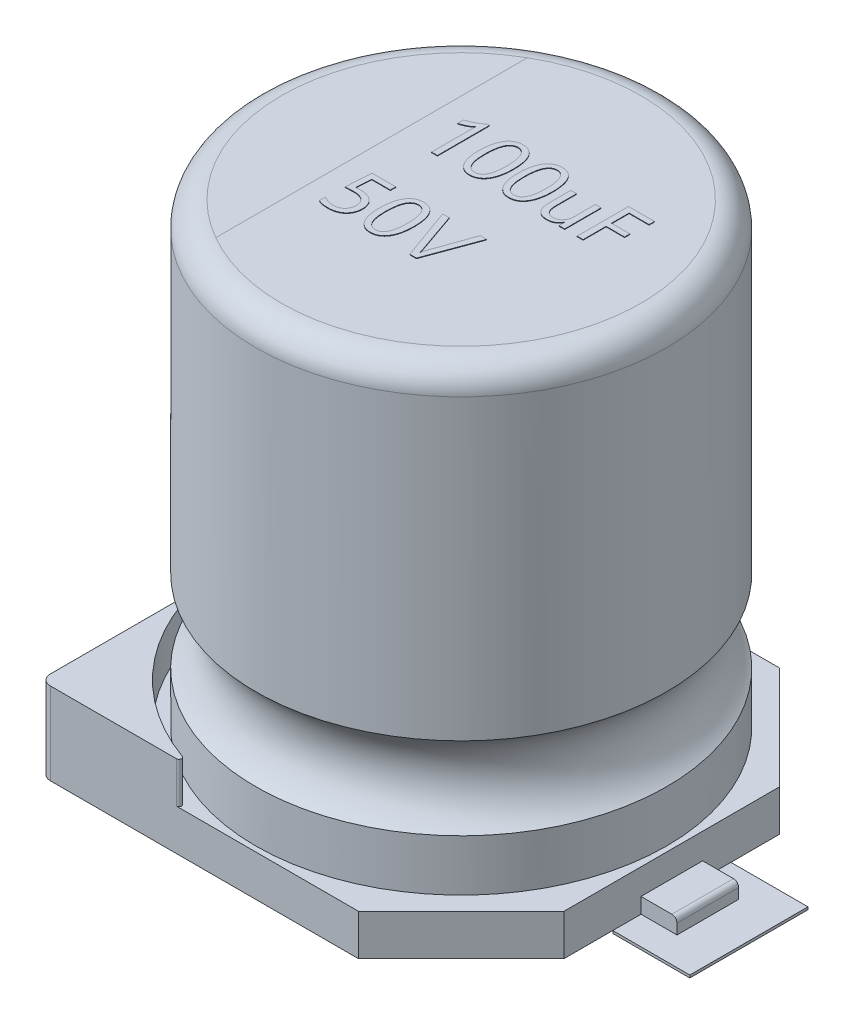
from build123d import *

# Parameters (mm, degrees)
SKETCH1_R             = 4
BOSS_EXTRUDE1_DEPTH   = 8.9
FILLET1_R             = 0.5
SKETCH3_W             = 8.2
SKETCH3_H             = 8.2
BOSS_EXTRUDE2_DEPTH   = 0.8
CHAMFER1_SIZE         = 2
BOSS_EXTRUDE3_DEPTH   = 0.8
FILLET2_R             = 0.05
SKETCH5_W             = 1.2
SKETCH5_H             = 0.3
BOSS_EXTRUDE4_DEPTH   = 0.7
FILLET3_R             = 0.1
FILLET4_R             = 0.2
BOSS_EXTRUDE5_DEPTH   = 0.01
SKETCH8_W             = 1.5
SKETCH8_H             = 2.3
BOSS_EXTRUDE6_DEPTH   = 0.05
BOSS_EXTRUDE6_2_DEPTH = 0.05


with BuildPart() as part:
    # Sketch1 → Boss-Extrude1 (new body)
    with BuildSketch(Plane(origin=(0, 0, 0), x_dir=(1, 0, 0), z_dir=(0, 1, 0))):
        Circle(SKETCH1_R)
    extrude(amount=BOSS_EXTRUDE1_DEPTH)

    # Sketch2 → Cut-Revolve1 (revolve, cut)
    with BuildSketch(Plane.XY):
        with BuildLine():
            Line((-4, 2.6), (-4, 1))
            ThreePointArc((-4, 1), (-3.6, 1.8), (-4, 2.6))
        make_face()
    revolve(axis=Axis((0, 0, 0), (0, 1, 0)), mode=Mode.SUBTRACT)

    # Fillet1
    fillet1_edges = [part.edges().sort_by_distance(p)[0] for p in [
        (-4, 8.9, 0),
    ]]
    fillet(fillet1_edges, radius=FILLET1_R)

    # Sketch7 → Boss-Extrude5 (add)
    # profile 1 of 8: a face of its own
    with BuildSketch(Plane(origin=(0, 8.9, 0), x_dir=(1, 0, 0), z_dir=(0, 1, 0))):
        with BuildLine():
            Line((-0.963431723, 0.500188603), (-1.07732975, 0.500188603))
            Line((-1.07732975, 0.500188603), (-1.07732975, 1.355040577))
            add(Edge.make_bspline(
                [(-1.07732975, 1.355040577), (-1.079777093, 1.352756928), (-1.085034792, 1.3478509), (-1.09387705, 1.340498161), (-1.104208441, 1.332640753), (-1.12049976, 1.321512017), (-1.14335142, 1.307312876), (-1.173085751, 1.290498318), (-1.20548104, 1.274747136), (-1.239040454, 1.259578397), (-1.273144639, 1.246529775), (-1.296298393, 1.240145156), (-1.307592907, 1.237030708)],
                knots=[0, 0, 0, 0, 0.385015468, 0.827139693, 1.322250538, 1.877706807, 3.096125656, 4.416274777, 5.805430079, 7.238282366, 8.652820666, 10, 10, 10, 10], degree=3))
            Line((-1.307592907, 1.237030708), (-1.307592907, 1.352162287))
            add(Edge.make_bspline(
                [(-1.307592907, 1.352162287), (-1.294653334, 1.35610978), (-1.267783898, 1.364306875), (-1.227473316, 1.380221553), (-1.186459456, 1.398993626), (-1.14575269, 1.419805536), (-1.106604769, 1.442327949), (-1.069663837, 1.465477943), (-1.036198144, 1.488813595), (-1.016101286, 1.505474617), (-1.006606065, 1.513346498)],
                knots=[0, 0, 0, 0, 0.94458981, 1.961470684, 3.023913207, 4.09427277, 5.153432408, 6.177318749, 7.138832524, 8, 8, 8, 8], degree=3))
            Line((-1.006606065, 1.513346498), (-0.963431723, 1.513346498))
            Line((-0.963431723, 1.513346498), (-0.963431723, 0.500188603))
        make_face()
    # profile 2 of 8: a face of its own
    with BuildSketch(Plane(origin=(0, 8.9, 0), x_dir=(1, 0, 0), z_dir=(0, 1, 0))):
        with BuildLine():
            add(Edge.make_bspline(
                [(0.005112685, 1.004711629), (0.004826131, 0.984557566), (0.004268968, 0.945370772), (0.00026028, 0.888304877), (-0.00697127, 0.834774088), (-0.01670279, 0.78474756), (-0.029197763, 0.738431643), (-0.044185511, 0.695758481), (-0.061768763, 0.65682236), (-0.081983566, 0.621736309), (-0.104311728, 0.590281443), (-0.129707187, 0.563262978), (-0.157079658, 0.539685765), (-0.187165811, 0.520517467), (-0.219425585, 0.505217818), (-0.254139435, 0.495007822), (-0.29072768, 0.488007663), (-0.315919286, 0.487360705), (-0.328768894, 0.487030708)],
                knots=[0, 0, 0, 0, 1.398980466, 2.720124312, 3.96812368, 5.146432578, 6.255415985, 7.295087503, 8.282879546, 9.216336252, 10.102253837, 10.953825877, 11.784043498, 12.603506409, 13.42284504, 14.253498671, 15.109153359, 16, 16, 16, 16], degree=3))
            add(Edge.make_bspline(
                [(-0.328768894, 0.487030708), (-0.340926926, 0.487403858), (-0.36472116, 0.488134142), (-0.399403608, 0.494513325), (-0.432131855, 0.504747043), (-0.462749696, 0.519260787), (-0.491170149, 0.537718507), (-0.517128174, 0.560078852), (-0.540797909, 0.586154425), (-0.562204288, 0.615858168), (-0.581056959, 0.649361911), (-0.597559877, 0.686395783), (-0.611358843, 0.727057537), (-0.623154052, 0.771117384), (-0.632024842, 0.818768253), (-0.638552103, 0.869693802), (-0.642510507, 0.923988105), (-0.642912284, 0.961256343), (-0.643119223, 0.980451761)],
                knots=[0, 0, 0, 0, 0.888155269, 1.738190458, 2.568434008, 3.38864091, 4.207101744, 5.03849325, 5.886044594, 6.7759361, 7.709272942, 8.69152049, 9.735599895, 10.845083744, 12.023162705, 13.27590253, 14.596923554, 16, 16, 16, 16], degree=3))
            add(Edge.make_bspline(
                [(-0.643119223, 0.980451761), (-0.642843557, 1.001497645), (-0.642307836, 1.042397677), (-0.638162264, 1.101825233), (-0.631477783, 1.157428823), (-0.622151233, 1.20925434), (-0.609844107, 1.257126333), (-0.595126484, 1.301093022), (-0.577891285, 1.341086758), (-0.557950963, 1.376997022), (-0.535517212, 1.40900922), (-0.510275956, 1.436746934), (-0.482599403, 1.460461121), (-0.452195954, 1.479788402), (-0.419394292, 1.49483533), (-0.384192765, 1.505504416), (-0.346852143, 1.512337738), (-0.321123895, 1.513005818), (-0.308004092, 1.513346498)],
                knots=[0, 0, 0, 0, 1.426258677, 2.771754592, 4.035124818, 5.220331935, 6.337825632, 7.382114204, 8.359741748, 9.284994213, 10.161296122, 11.002979272, 11.820109764, 12.624106341, 13.436709906, 14.257961594, 15.111668944, 16, 16, 16, 16], degree=3))
            add(Edge.make_bspline(
                [(-0.308004092, 1.513346498), (-0.295368868, 1.512959369), (-0.270705783, 1.512203721), (-0.23495184, 1.506094994), (-0.201540462, 1.496387059), (-0.170760666, 1.482139609), (-0.14236875, 1.464156343), (-0.116378867, 1.442121729), (-0.09317833, 1.415950319), (-0.072122691, 1.3860259), (-0.054102459, 1.351883719), (-0.03785807, 1.31408476), (-0.024755916, 1.272056949), (-0.013614383, 1.226276634), (-0.005386797, 1.176431001), (0.000747166, 1.12277945), (0.004461983, 1.065070853), (0.004890986, 1.025276442), (0.005112685, 1.004711629)],
                knots=[0, 0, 0, 0, 0.899241396, 1.755257189, 2.575108327, 3.369931066, 4.161902333, 4.96169813, 5.78762661, 6.645962214, 7.56082504, 8.531597655, 9.571777694, 10.691464586, 11.88443752, 13.166498411, 14.535713275, 16, 16, 16, 16], degree=3))
        make_face()
        with BuildLine():
            add(Edge.make_bspline(
                [(-0.111458039, 0.993198471), (-0.111635005, 1.010469562), (-0.111977861, 1.043930687), (-0.114064832, 1.092507874), (-0.118353658, 1.137667761), (-0.12339049, 1.179587018), (-0.13070288, 1.218050581), (-0.139128469, 1.253280964), (-0.149453536, 1.285169971), (-0.161197046, 1.313719893), (-0.174667974, 1.338955551), (-0.189638832, 1.360931968), (-0.206310236, 1.379614653), (-0.224648836, 1.394887973), (-0.244573932, 1.406866101), (-0.266277141, 1.414960968), (-0.289367294, 1.420441518), (-0.305366891, 1.42097051), (-0.313555079, 1.421241235)],
                knots=[0, 0, 0, 0, 1.581181307, 3.063391078, 4.449305256, 5.73327765, 6.92683892, 8.031533681, 9.047337031, 9.992258722, 10.853979057, 11.661441156, 12.421081853, 13.138403699, 13.838846326, 14.537910874, 15.251739941, 16, 16, 16, 16], degree=3))
            add(Edge.make_bspline(
                [(-0.313555079, 1.421241235), (-0.322149139, 1.420956637), (-0.339019139, 1.420397978), (-0.363407175, 1.415083426), (-0.386204613, 1.406638965), (-0.407231815, 1.394518687), (-0.426456861, 1.378867186), (-0.444102981, 1.359920592), (-0.459894199, 1.337502337), (-0.474045623, 1.311820005), (-0.486699712, 1.28281579), (-0.497086535, 1.250213365), (-0.506460167, 1.214429829), (-0.513622413, 1.175157744), (-0.519677256, 1.132653105), (-0.523608913, 1.086666414), (-0.526124054, 1.037292279), (-0.52640388, 1.003207366), (-0.5265485, 0.985591563)],
                knots=[0, 0, 0, 0, 0.764995805, 1.501674303, 2.212925961, 2.924256282, 3.65393935, 4.414460527, 5.224546987, 6.091227052, 7.023912083, 8.039810551, 9.137474513, 10.318540051, 11.595133009, 12.962565651, 14.430189818, 16, 16, 16, 16], degree=3))
            add(Edge.make_bspline(
                [(-0.5265485, 0.985591563), (-0.526402041, 0.969209241), (-0.526118139, 0.937452912), (-0.523614364, 0.891364271), (-0.519634554, 0.848405362), (-0.513809401, 0.808633363), (-0.506874679, 0.771954437), (-0.497741057, 0.738621381), (-0.487380411, 0.708264032), (-0.475039657, 0.681192385), (-0.461392387, 0.656982181), (-0.445580087, 0.636351776), (-0.428514073, 0.618478865), (-0.409363524, 0.604260881), (-0.388775468, 0.592951387), (-0.366538931, 0.58487104), (-0.342611158, 0.580072872), (-0.326118398, 0.579453407), (-0.317666921, 0.579135971)],
                knots=[0, 0, 0, 0, 1.543513286, 2.992024866, 4.347767877, 5.607075833, 6.778486024, 7.862468221, 8.861099137, 9.797386861, 10.662401359, 11.473455982, 12.240599663, 12.983190345, 13.711379138, 14.446775782, 15.204072658, 16, 16, 16, 16], degree=3))
            add(Edge.make_bspline(
                [(-0.317666921, 0.579135971), (-0.309354713, 0.579462603), (-0.293070777, 0.580102486), (-0.269360779, 0.584815964), (-0.247382033, 0.593201099), (-0.226927748, 0.604593384), (-0.208308613, 0.619420262), (-0.191318052, 0.637397511), (-0.175736559, 0.658496883), (-0.162459537, 0.683184252), (-0.150125444, 0.710733256), (-0.13984854, 0.741627939), (-0.130992629, 0.77569519), (-0.123969588, 0.813015594), (-0.118126249, 0.85347046), (-0.114459312, 0.897202574), (-0.111866128, 0.944099177), (-0.111597053, 0.976472965), (-0.111458039, 0.993198471)],
                knots=[0, 0, 0, 0, 0.775360401, 1.518961016, 2.243373551, 2.96192122, 3.694889719, 4.454670758, 5.264184671, 6.134259122, 7.064577354, 8.077594077, 9.167837551, 10.346585987, 11.618858978, 12.979815247, 14.439659868, 16, 16, 16, 16], degree=3))
        make_face(mode=Mode.SUBTRACT)
    # profile 3 of 8: a face of its own
    with BuildSketch(Plane(origin=(0, 8.9, 0), x_dir=(1, 0, 0), z_dir=(0, 1, 0))):
        with BuildLine():
            add(Edge.make_bspline(
                [(0.768270579, 1.004711629), (0.767984026, 0.984557566), (0.767426863, 0.945370772), (0.763418175, 0.888304877), (0.756186625, 0.834774088), (0.746455105, 0.78474756), (0.733960132, 0.738431643), (0.718972384, 0.695758481), (0.701389132, 0.65682236), (0.681174329, 0.621736309), (0.658846167, 0.590281443), (0.633450707, 0.563262978), (0.606078237, 0.539685765), (0.575992083, 0.520517467), (0.54373231, 0.505217818), (0.50901846, 0.495007822), (0.472430214, 0.488007663), (0.447238608, 0.487360705), (0.434389, 0.487030708)],
                knots=[0, 0, 0, 0, 1.398980466, 2.720124312, 3.96812368, 5.146432578, 6.255415985, 7.295087503, 8.282879546, 9.216336252, 10.102253837, 10.953825877, 11.784043498, 12.603506409, 13.42284504, 14.253498671, 15.109153359, 16, 16, 16, 16], degree=3))
            add(Edge.make_bspline(
                [(0.434389, 0.487030708), (0.422230969, 0.487403858), (0.398436735, 0.488134142), (0.363754287, 0.494513325), (0.331026039, 0.504747043), (0.300408199, 0.519260787), (0.271987746, 0.537718507), (0.246029721, 0.560078852), (0.222359986, 0.586154425), (0.200953607, 0.615858168), (0.182100935, 0.649361911), (0.165598018, 0.686395783), (0.151799052, 0.727057537), (0.140003843, 0.771117384), (0.131133053, 0.818768253), (0.124605791, 0.869693802), (0.120647388, 0.923988105), (0.120245611, 0.961256343), (0.120038671, 0.980451761)],
                knots=[0, 0, 0, 0, 0.888155269, 1.738190458, 2.568434008, 3.38864091, 4.207101744, 5.03849325, 5.886044594, 6.7759361, 7.709272942, 8.69152049, 9.735599895, 10.845083744, 12.023162705, 13.27590253, 14.596923554, 16, 16, 16, 16], degree=3))
            add(Edge.make_bspline(
                [(0.120038671, 0.980451761), (0.120314337, 1.001497645), (0.120850059, 1.042397677), (0.124995631, 1.101825233), (0.131680111, 1.157428823), (0.141006661, 1.20925434), (0.153313788, 1.257126333), (0.168031411, 1.301093022), (0.18526661, 1.341086758), (0.205206931, 1.376997022), (0.227640682, 1.40900922), (0.252881939, 1.436746934), (0.280558491, 1.460461121), (0.31096194, 1.479788402), (0.343763603, 1.49483533), (0.37896513, 1.505504416), (0.416305751, 1.512337738), (0.442033999, 1.513005818), (0.455153803, 1.513346498)],
                knots=[0, 0, 0, 0, 1.426258677, 2.771754592, 4.035124818, 5.220331935, 6.337825632, 7.382114204, 8.359741748, 9.284994213, 10.161296122, 11.002979272, 11.820109764, 12.624106341, 13.436709906, 14.257961594, 15.111668944, 16, 16, 16, 16], degree=3))
            add(Edge.make_bspline(
                [(0.455153803, 1.513346498), (0.467789027, 1.512959369), (0.492452111, 1.512203721), (0.528206054, 1.506094994), (0.561617433, 1.496387059), (0.592397229, 1.482139609), (0.620789145, 1.464156343), (0.646779028, 1.442121729), (0.669979565, 1.415950319), (0.691035204, 1.3860259), (0.709055435, 1.351883719), (0.725299825, 1.31408476), (0.738401979, 1.272056949), (0.749543511, 1.226276634), (0.757771097, 1.176431001), (0.763905061, 1.12277945), (0.767619878, 1.065070853), (0.768048881, 1.025276442), (0.768270579, 1.004711629)],
                knots=[0, 0, 0, 0, 0.899241396, 1.755257189, 2.575108327, 3.369931066, 4.161902333, 4.96169813, 5.78762661, 6.645962214, 7.56082504, 8.531597655, 9.571777694, 10.691464586, 11.88443752, 13.166498411, 14.535713275, 16, 16, 16, 16], degree=3))
        make_face()
        with BuildLine():
            add(Edge.make_bspline(
                [(0.651699856, 0.993198471), (0.651522889, 1.010469562), (0.651180034, 1.043930687), (0.649093063, 1.092507874), (0.644804237, 1.137667761), (0.639767405, 1.179587018), (0.632455014, 1.218050581), (0.624029426, 1.253280964), (0.613704359, 1.285169971), (0.601960849, 1.313719893), (0.588489921, 1.338955551), (0.573519063, 1.360931968), (0.556847658, 1.379614653), (0.538509059, 1.394887973), (0.518583963, 1.406866101), (0.496880754, 1.414960968), (0.473790601, 1.420441518), (0.457791004, 1.42097051), (0.449602816, 1.421241235)],
                knots=[0, 0, 0, 0, 1.581181307, 3.063391078, 4.449305256, 5.73327765, 6.92683892, 8.031533681, 9.047337031, 9.992258722, 10.853979057, 11.661441156, 12.421081853, 13.138403699, 13.838846326, 14.537910874, 15.251739941, 16, 16, 16, 16], degree=3))
            add(Edge.make_bspline(
                [(0.449602816, 1.421241235), (0.441008756, 1.420956637), (0.424138756, 1.420397978), (0.39975072, 1.415083426), (0.376953282, 1.406638965), (0.35592608, 1.394518687), (0.336701034, 1.378867186), (0.319054913, 1.359920592), (0.303263696, 1.337502337), (0.289112272, 1.311820005), (0.276458182, 1.28281579), (0.26607136, 1.250213365), (0.256697728, 1.214429829), (0.249535481, 1.175157744), (0.243480639, 1.132653105), (0.239548982, 1.086666414), (0.23703384, 1.037292279), (0.236754015, 1.003207366), (0.236609395, 0.985591563)],
                knots=[0, 0, 0, 0, 0.764995805, 1.501674303, 2.212925961, 2.924256282, 3.65393935, 4.414460527, 5.224546987, 6.091227052, 7.023912083, 8.039810551, 9.137474513, 10.318540051, 11.595133009, 12.962565651, 14.430189818, 16, 16, 16, 16], degree=3))
            add(Edge.make_bspline(
                [(0.236609395, 0.985591563), (0.236755854, 0.969209241), (0.237039756, 0.937452912), (0.239543531, 0.891364271), (0.243523341, 0.848405362), (0.249348493, 0.808633363), (0.256283216, 0.771954437), (0.265416837, 0.738621381), (0.275777484, 0.708264032), (0.288118237, 0.681192385), (0.301765507, 0.656982181), (0.317577808, 0.636351776), (0.334643822, 0.618478865), (0.35379437, 0.604260881), (0.374382427, 0.592951387), (0.396618963, 0.58487104), (0.420546736, 0.580072872), (0.437039497, 0.579453407), (0.445490974, 0.579135971)],
                knots=[0, 0, 0, 0, 1.543513286, 2.992024866, 4.347767877, 5.607075833, 6.778486024, 7.862468221, 8.861099137, 9.797386861, 10.662401359, 11.473455982, 12.240599663, 12.983190345, 13.711379138, 14.446775782, 15.204072658, 16, 16, 16, 16], degree=3))
            add(Edge.make_bspline(
                [(0.445490974, 0.579135971), (0.453803181, 0.579462603), (0.470087117, 0.580102486), (0.493797116, 0.584815964), (0.515775862, 0.593201099), (0.536230147, 0.604593384), (0.554849281, 0.619420262), (0.571839842, 0.637397511), (0.587421335, 0.658496883), (0.600698358, 0.683184252), (0.61303245, 0.710733256), (0.623309355, 0.741627939), (0.632165265, 0.77569519), (0.639188306, 0.813015594), (0.645031646, 0.85347046), (0.648698582, 0.897202574), (0.651291767, 0.944099177), (0.651560842, 0.976472965), (0.651699856, 0.993198471)],
                knots=[0, 0, 0, 0, 0.775360401, 1.518961016, 2.243373551, 2.96192122, 3.694889719, 4.454670758, 5.264184671, 6.134259122, 7.064577354, 8.077594077, 9.167837551, 10.346585987, 11.618858978, 12.979815247, 14.439659868, 16, 16, 16, 16], degree=3))
        make_face(mode=Mode.SUBTRACT)
    # profile 4 of 8: a face of its own
    with BuildSketch(Plane(origin=(0, 8.9, 0), x_dir=(1, 0, 0), z_dir=(0, 1, 0))):
        with BuildLine():
            Line((1.513336369, 0.500188603), (1.399438343, 0.500188603))
            Line((1.399438343, 0.500188603), (1.399438343, 0.612441892))
            Line((1.399438343, 0.612441892), (1.396765645, 0.612441892))
            add(Edge.make_bspline(
                [(1.396765645, 0.612441892), (1.390720663, 0.602460299), (1.378922171, 0.5829784), (1.357224617, 0.557406109), (1.333497285, 0.535340747), (1.30679844, 0.517874984), (1.27796377, 0.503876254), (1.246605155, 0.493991312), (1.212766798, 0.488233325), (1.189414343, 0.487439271), (1.177398869, 0.487030708)],
                knots=[0, 0, 0, 0, 1.050691007, 2.050720406, 3.012962404, 3.962401766, 4.915874185, 5.894932476, 6.916885468, 8, 8, 8, 8], degree=3))
            add(Edge.make_bspline(
                [(1.177398869, 0.487030708), (1.167106673, 0.487257871), (1.147213655, 0.487696936), (1.11834269, 0.491353296), (1.091359331, 0.496789144), (1.066537263, 0.505487129), (1.043447569, 0.515877394), (1.022427463, 0.528850187), (1.003437756, 0.544280218), (0.986572548, 0.56212546), (0.971356904, 0.582119485), (0.958722421, 0.604808693), (0.947754222, 0.629646774), (0.938794621, 0.656780083), (0.931760999, 0.68627913), (0.926955997, 0.718120739), (0.92409119, 0.75232886), (0.923696159, 0.775881872), (0.923492619, 0.78801755)],
                knots=[0, 0, 0, 0, 1.09540131, 2.117219514, 3.094696566, 4.020015321, 4.911365501, 5.786165053, 6.642013186, 7.509079247, 8.394916856, 9.30993597, 10.267157936, 11.282441873, 12.347880503, 13.49236844, 14.707944063, 16, 16, 16, 16], degree=3))
            Line((0.923492619, 0.78801755), (0.923492619, 1.210714919))
            Line((0.923492619, 1.210714919), (1.036568277, 1.210714919))
            Line((1.036568277, 1.210714919), (1.036568277, 0.804053735))
            add(Edge.make_bspline(
                [(1.036568277, 0.804053735), (1.036658129, 0.79500285), (1.03683264, 0.777424219), (1.038994686, 0.751898193), (1.042143232, 0.72804247), (1.046826816, 0.705955212), (1.053044542, 0.68569587), (1.060388214, 0.66715835), (1.068975395, 0.650310847), (1.079241694, 0.635355566), (1.090611126, 0.621958112), (1.103608072, 0.610479502), (1.117877537, 0.600820717), (1.133413594, 0.592673278), (1.150370126, 0.586537416), (1.168663857, 0.582288295), (1.188210634, 0.579518344), (1.201717402, 0.57926565), (1.208648869, 0.579135971)],
                knots=[0, 0, 0, 0, 1.343703186, 2.609740898, 3.801442941, 4.915248641, 5.95827345, 6.944754588, 7.873313373, 8.759642607, 9.632786239, 10.476245362, 11.325882859, 12.18618061, 13.074785555, 13.995503533, 14.971323121, 16, 16, 16, 16], degree=3))
            add(Edge.make_bspline(
                [(1.208648869, 0.579135971), (1.215444264, 0.579340895), (1.228822529, 0.579744332), (1.248382544, 0.582703586), (1.267049545, 0.587339775), (1.284654366, 0.594262065), (1.301392063, 0.602948489), (1.317350699, 0.613434023), (1.332147143, 0.626102121), (1.345940795, 0.640486012), (1.358314303, 0.656498858), (1.369603949, 0.673539607), (1.378805849, 0.692024015), (1.38648315, 0.711539654), (1.39212846, 0.732324927), (1.396555207, 0.754141181), (1.398974255, 0.77727204), (1.39928124, 0.793083669), (1.399438343, 0.801175445)],
                knots=[0, 0, 0, 0, 0.99348202, 1.955893163, 2.886897847, 3.800751478, 4.715209456, 5.640858053, 6.586634716, 7.557773505, 8.550193329, 9.542613152, 10.542143211, 11.563936364, 12.604722674, 13.687744657, 14.816677783, 16, 16, 16, 16], degree=3))
            Line((1.399438343, 0.801175445), (1.399438343, 1.210714919))
            Line((1.399438343, 1.210714919), (1.513336369, 1.210714919))
            Line((1.513336369, 1.210714919), (1.513336369, 0.500188603))
        make_face()
    # profile 5 of 8: a face of its own
    with BuildSketch(Plane(origin=(0, 8.9, 0), x_dir=(1, 0, 0), z_dir=(0, 1, 0))):
        Polygon((2.261897224, 1.394925445), (1.873328145, 1.394925445), (1.873328145, 1.052820182), (2.232703145, 1.052820182), (2.232703145, 0.947557024), (1.873328145, 0.947557024), (1.873328145, 0.500188603), (1.756757421, 0.500188603), (1.756757421, 1.500188603), (2.261897224, 1.500188603), align=None)
    # profile 6 of 8: a face of its own
    with BuildSketch(Plane(origin=(0, 8.9, 0), x_dir=(1, 0, 0), z_dir=(0, 1, 0))):
        with BuildLine():
            add(Edge.make_bspline(
                [(-0.793612644, -1.127775788), (-0.793960298, -1.139574748), (-0.794642043, -1.162712395), (-0.799064628, -1.196669956), (-0.807223545, -1.228776685), (-0.818031971, -1.259148157), (-0.831964387, -1.287475253), (-0.84837346, -1.313832799), (-0.867512243, -1.338196132), (-0.889334264, -1.360347166), (-0.913582321, -1.380386349), (-0.94053288, -1.397725884), (-0.969631482, -1.413005561), (-1.001266549, -1.425393112), (-1.034752556, -1.435646199), (-1.070265746, -1.44238049), (-1.107502327, -1.4469306), (-1.132962205, -1.447424321), (-1.145997513, -1.447677104)],
                knots=[0, 0, 0, 0, 1.056864167, 2.072500419, 3.059485391, 4.018613275, 4.954681828, 5.881162702, 6.794724112, 7.723560484, 8.661137091, 9.605998599, 10.588833302, 11.59982216, 12.644532083, 13.720683555, 14.833003331, 16, 16, 16, 16], degree=3))
            add(Edge.make_bspline(
                [(-1.145997513, -1.447677104), (-1.157169676, -1.44755688), (-1.178844942, -1.447323631), (-1.210217715, -1.445589255), (-1.239346016, -1.442162006), (-1.266312612, -1.438066715), (-1.291036625, -1.432285861), (-1.313517302, -1.425324282), (-1.333853616, -1.417259251), (-1.346100363, -1.410454138), (-1.352000802, -1.407175459)],
                knots=[0, 0, 0, 0, 1.263126396, 2.450608766, 3.550077914, 4.578015321, 5.532741343, 6.41739748, 7.237507678, 8, 8, 8, 8], degree=3))
            Line((-1.352000802, -1.407175459), (-1.352000802, -1.289782367))
            add(Edge.make_bspline(
                [(-1.352000802, -1.289782367), (-1.343644519, -1.295047632), (-1.327115968, -1.305462213), (-1.301398701, -1.318689721), (-1.275672137, -1.330073303), (-1.249798347, -1.339444348), (-1.223733025, -1.346605094), (-1.1974887, -1.351776104), (-1.171090993, -1.354979568), (-1.153407625, -1.355374304), (-1.144558368, -1.35557184)],
                knots=[0, 0, 0, 0, 1.073575538, 2.123509434, 3.141212585, 4.131255582, 5.1129617, 6.077547705, 7.037950563, 8, 8, 8, 8], degree=3))
            add(Edge.make_bspline(
                [(-1.144558368, -1.35557184), (-1.13577573, -1.355388981), (-1.118565534, -1.355030654), (-1.09348191, -1.351802344), (-1.069600723, -1.347029456), (-1.047197078, -1.339744061), (-1.026294475, -1.330749682), (-1.00693468, -1.320167604), (-0.989181315, -1.308039635), (-0.973029778, -1.29419492), (-0.958648025, -1.278678747), (-0.94576485, -1.261858724), (-0.93509558, -1.243311522), (-0.926051079, -1.223573267), (-0.918714709, -1.20255171), (-0.914035937, -1.180358364), (-0.910707996, -1.157275006), (-0.910360819, -1.141563111), (-0.910183368, -1.133532367)],
                knots=[0, 0, 0, 0, 1.158660806, 2.270477318, 3.333079092, 4.368579658, 5.373363954, 6.332745853, 7.27608927, 8.206156569, 9.134110276, 10.063957633, 10.99630925, 11.951503368, 12.926911662, 13.927616427, 14.940752784, 16, 16, 16, 16], degree=3))
            add(Edge.make_bspline(
                [(-0.910183368, -1.133532367), (-0.910372696, -1.125504516), (-0.91074311, -1.109798279), (-0.913878157, -1.086857782), (-0.919040275, -1.065263813), (-0.925899626, -1.044864207), (-0.935384798, -1.026114831), (-0.9463914, -1.008384945), (-0.960003861, -0.992409341), (-0.97515884, -0.977427808), (-0.992551618, -0.964366436), (-1.011647661, -0.952710772), (-1.032630564, -0.942803068), (-1.055603774, -0.9351487), (-1.080270122, -0.928920598), (-1.106733846, -0.924473626), (-1.135111939, -0.921743454), (-1.154625896, -0.921491479), (-1.164706394, -0.921361314)],
                knots=[0, 0, 0, 0, 1.024220939, 2.003855773, 2.947861307, 3.855091956, 4.742976808, 5.623725423, 6.511739495, 7.414744547, 8.338353125, 9.280330718, 10.266270024, 11.292393647, 12.365736532, 13.510265708, 14.713855882, 16, 16, 16, 16], degree=3))
            add(Edge.make_bspline(
                [(-1.164706394, -0.921361314), (-1.171560192, -0.921394443), (-1.185681562, -0.921462702), (-1.207193389, -0.922254008), (-1.229272396, -0.922665261), (-1.25139504, -0.923887785), (-1.27327405, -0.924724478), (-1.294443985, -0.926244892), (-1.314396907, -0.92779629), (-1.327195143, -0.929147098), (-1.333291921, -0.92979059)],
                knots=[0, 0, 0, 0, 0.974070636, 2.006947305, 3.059296761, 4.112367188, 5.155707916, 6.170982707, 7.128699404, 8, 8, 8, 8], degree=3))
            Line((-1.333291921, -0.92979059), (-1.299369223, -0.434519209))
            Line((-1.299369223, -0.434519209), (-0.839254092, -0.434519209))
            Line((-0.839254092, -0.434519209), (-0.839254092, -0.539782367))
            Line((-0.839254092, -0.539782367), (-1.200890605, -0.539782367))
            Line((-1.200890605, -0.539782367), (-1.221038631, -0.832751117))
            add(Edge.make_bspline(
                [(-1.221038631, -0.832751117), (-1.213433803, -0.832230981), (-1.197753352, -0.831158508), (-1.174165049, -0.830322134), (-1.151213288, -0.829335855), (-1.13633566, -0.829281563), (-1.129344552, -0.829256051)],
                knots=[0, 0, 0, 0, 0.996597619, 2.054892104, 3.085979286, 4, 4, 4, 4], degree=3))
            add(Edge.make_bspline(
                [(-1.129344552, -0.829256051), (-1.116519915, -0.829471408), (-1.091424837, -0.829892817), (-1.054899457, -0.83379702), (-1.020478392, -0.840447124), (-0.98815701, -0.849354217), (-0.958105906, -0.860993658), (-0.930105297, -0.874409082), (-0.904774709, -0.890581171), (-0.881781042, -0.908719161), (-0.861256526, -0.929021564), (-0.843194455, -0.95146848), (-0.828236963, -0.976424175), (-0.815624804, -1.003198072), (-0.805826391, -1.031899989), (-0.798506648, -1.0622926), (-0.794472337, -1.094497952), (-0.793903264, -1.116526179), (-0.793612644, -1.127775788)],
                knots=[0, 0, 0, 0, 1.209722839, 2.367169476, 3.460249484, 4.51448871, 5.52555128, 6.497162283, 7.438882481, 8.354766373, 9.255461188, 10.15719975, 11.065382765, 11.993869493, 12.944690782, 13.921729643, 14.938646801, 16, 16, 16, 16], degree=3))
        make_face()
    # profile 7 of 8: a face of its own
    with BuildSketch(Plane(origin=(0, 8.9, 0), x_dir=(1, 0, 0), z_dir=(0, 1, 0))):
        with BuildLine():
            add(Edge.make_bspline(
                [(0.005112685, -0.929996183), (0.004826131, -0.950150246), (0.004268968, -0.98933704), (0.00026028, -1.046402935), (-0.00697127, -1.099933724), (-0.01670279, -1.149960252), (-0.029197763, -1.196276169), (-0.044185511, -1.238949331), (-0.061768763, -1.277885452), (-0.081983566, -1.312971503), (-0.104311728, -1.344426369), (-0.129707187, -1.371444834), (-0.157079658, -1.395022046), (-0.187165811, -1.414190345), (-0.219425585, -1.429489994), (-0.254139435, -1.43969999), (-0.29072768, -1.446700149), (-0.315919286, -1.447347107), (-0.328768894, -1.447677104)],
                knots=[0, 0, 0, 0, 1.398980466, 2.720124312, 3.96812368, 5.146432578, 6.255415985, 7.295087503, 8.282879546, 9.216336252, 10.102253837, 10.953825877, 11.784043498, 12.603506409, 13.42284504, 14.253498671, 15.109153359, 16, 16, 16, 16], degree=3))
            add(Edge.make_bspline(
                [(-0.328768894, -1.447677104), (-0.340926926, -1.447303954), (-0.36472116, -1.44657367), (-0.399403608, -1.440194487), (-0.432131855, -1.429960769), (-0.462749696, -1.415447025), (-0.491170149, -1.396989305), (-0.517128174, -1.37462896), (-0.540797909, -1.348553387), (-0.562204288, -1.318849644), (-0.581056959, -1.285345901), (-0.597559877, -1.248312029), (-0.611358843, -1.207650274), (-0.623154052, -1.163590428), (-0.632024842, -1.115939559), (-0.638552103, -1.06501401), (-0.642510507, -1.010719707), (-0.642912284, -0.973451468), (-0.643119223, -0.954256051)],
                knots=[0, 0, 0, 0, 0.888155269, 1.738190458, 2.568434008, 3.38864091, 4.207101744, 5.03849325, 5.886044594, 6.7759361, 7.709272942, 8.69152049, 9.735599895, 10.845083744, 12.023162705, 13.27590253, 14.596923554, 16, 16, 16, 16], degree=3))
            add(Edge.make_bspline(
                [(-0.643119223, -0.954256051), (-0.642843557, -0.933210167), (-0.642307836, -0.892310135), (-0.638162264, -0.832882579), (-0.631477783, -0.777278988), (-0.622151233, -0.725453472), (-0.609844107, -0.677581479), (-0.595126484, -0.63361479), (-0.577891285, -0.593621054), (-0.557950963, -0.55771079), (-0.535517212, -0.525698592), (-0.510275956, -0.497960878), (-0.482599403, -0.47424669), (-0.452195954, -0.45491941), (-0.419394292, -0.439872482), (-0.384192765, -0.429203396), (-0.346852143, -0.422370074), (-0.321123895, -0.421701993), (-0.308004092, -0.421361314)],
                knots=[0, 0, 0, 0, 1.426258677, 2.771754592, 4.035124818, 5.220331935, 6.337825632, 7.382114204, 8.359741748, 9.284994213, 10.161296122, 11.002979272, 11.820109764, 12.624106341, 13.436709906, 14.257961594, 15.111668944, 16, 16, 16, 16], degree=3))
            add(Edge.make_bspline(
                [(-0.308004092, -0.421361314), (-0.295368868, -0.421748443), (-0.270705783, -0.422504091), (-0.23495184, -0.428612818), (-0.201540462, -0.438320753), (-0.170760666, -0.452568203), (-0.14236875, -0.470551469), (-0.116378867, -0.492586082), (-0.09317833, -0.518757492), (-0.072122691, -0.548681912), (-0.054102459, -0.582824092), (-0.03785807, -0.620623051), (-0.024755916, -0.662650863), (-0.013614383, -0.708431178), (-0.005386797, -0.75827681), (0.000747166, -0.811928362), (0.004461983, -0.869636959), (0.004890986, -0.90943137), (0.005112685, -0.929996183)],
                knots=[0, 0, 0, 0, 0.899241396, 1.755257189, 2.575108327, 3.369931066, 4.161902333, 4.96169813, 5.78762661, 6.645962214, 7.56082504, 8.531597655, 9.571777694, 10.691464586, 11.88443752, 13.166498411, 14.535713275, 16, 16, 16, 16], degree=3))
        make_face()
        with BuildLine():
            add(Edge.make_bspline(
                [(-0.111458039, -0.94150934), (-0.111635005, -0.92423825), (-0.111977861, -0.890777124), (-0.114064832, -0.842199937), (-0.118353658, -0.797040051), (-0.12339049, -0.755120794), (-0.13070288, -0.716657231), (-0.139128469, -0.681426848), (-0.149453536, -0.649537841), (-0.161197046, -0.620987919), (-0.174667974, -0.595752261), (-0.189638832, -0.573775843), (-0.206310236, -0.555093158), (-0.224648836, -0.539819839), (-0.244573932, -0.527841711), (-0.266277141, -0.519746844), (-0.289367294, -0.514266294), (-0.305366891, -0.513737302), (-0.313555079, -0.513466577)],
                knots=[0, 0, 0, 0, 1.581181307, 3.063391078, 4.449305256, 5.73327765, 6.92683892, 8.031533681, 9.047337031, 9.992258722, 10.853979057, 11.661441156, 12.421081853, 13.138403699, 13.838846326, 14.537910874, 15.251739941, 16, 16, 16, 16], degree=3))
            add(Edge.make_bspline(
                [(-0.313555079, -0.513466577), (-0.322149139, -0.513751174), (-0.339019139, -0.514309834), (-0.363407175, -0.519624386), (-0.386204613, -0.528068847), (-0.407231815, -0.540189125), (-0.426456861, -0.555840626), (-0.444102981, -0.57478722), (-0.459894199, -0.597205475), (-0.474045623, -0.622887807), (-0.486699712, -0.651892022), (-0.497086535, -0.684494447), (-0.506460167, -0.720277983), (-0.513622413, -0.759550068), (-0.519677256, -0.802054707), (-0.523608913, -0.848041398), (-0.526124054, -0.897415533), (-0.52640388, -0.931500446), (-0.5265485, -0.949116248)],
                knots=[0, 0, 0, 0, 0.764995805, 1.501674303, 2.212925961, 2.924256282, 3.65393935, 4.414460527, 5.224546987, 6.091227052, 7.023912083, 8.039810551, 9.137474513, 10.318540051, 11.595133009, 12.962565651, 14.430189818, 16, 16, 16, 16], degree=3))
            add(Edge.make_bspline(
                [(-0.5265485, -0.949116248), (-0.526402041, -0.965498571), (-0.526118139, -0.9972549), (-0.523614364, -1.043343541), (-0.519634554, -1.08630245), (-0.513809401, -1.126074449), (-0.506874679, -1.162753375), (-0.497741057, -1.196086431), (-0.487380411, -1.22644378), (-0.475039657, -1.253515427), (-0.461392387, -1.277725631), (-0.445580087, -1.298356036), (-0.428514073, -1.316228946), (-0.409363524, -1.330446931), (-0.388775468, -1.341756424), (-0.366538931, -1.349836772), (-0.342611158, -1.35463494), (-0.326118398, -1.355254405), (-0.317666921, -1.35557184)],
                knots=[0, 0, 0, 0, 1.543513286, 2.992024866, 4.347767877, 5.607075833, 6.778486024, 7.862468221, 8.861099137, 9.797386861, 10.662401359, 11.473455982, 12.240599663, 12.983190345, 13.711379138, 14.446775782, 15.204072658, 16, 16, 16, 16], degree=3))
            add(Edge.make_bspline(
                [(-0.317666921, -1.35557184), (-0.309354713, -1.355245209), (-0.293070777, -1.354605326), (-0.269360779, -1.349891848), (-0.247382033, -1.341506713), (-0.226927748, -1.330114428), (-0.208308613, -1.31528755), (-0.191318052, -1.297310301), (-0.175736559, -1.276210929), (-0.162459537, -1.25152356), (-0.150125444, -1.223974556), (-0.13984854, -1.193079873), (-0.130992629, -1.159012622), (-0.123969588, -1.121692217), (-0.118126249, -1.081237352), (-0.114459312, -1.037505238), (-0.111866128, -0.990608635), (-0.111597053, -0.958234847), (-0.111458039, -0.94150934)],
                knots=[0, 0, 0, 0, 0.775360401, 1.518961016, 2.243373551, 2.96192122, 3.694889719, 4.454670758, 5.264184671, 6.134259122, 7.064577354, 8.077594077, 9.167837551, 10.346585987, 11.618858978, 12.979815247, 14.439659868, 16, 16, 16, 16], degree=3))
        make_face(mode=Mode.SUBTRACT)
    # profile 8 of 8: a face of its own
    with BuildSketch(Plane(origin=(0, 8.9, 0), x_dir=(1, 0, 0), z_dir=(0, 1, 0))):
        with BuildLine():
            Line((0.93048275, -0.434519209), (0.562061698, -1.434519209))
            Line((0.562061698, -1.434519209), (0.433772224, -1.434519209))
            Line((0.433772224, -1.434519209), (0.072958079, -0.434519209))
            Line((0.072958079, -0.434519209), (0.202686698, -0.434519209))
            Line((0.202686698, -0.434519209), (0.478180119, -1.227282367))
            add(Edge.make_bspline(
                [(0.478180119, -1.227282367), (0.480292487, -1.233912657), (0.48464027, -1.247559459), (0.490253492, -1.26899756), (0.494618629, -1.291975053), (0.497072805, -1.307798624), (0.498328145, -1.315892564)],
                knots=[0, 0, 0, 0, 0.917522195, 1.888491001, 2.919938635, 4, 4, 4, 4], degree=3))
            Line((0.498328145, -1.315892564), (0.501000843, -1.315892564))
            add(Edge.make_bspline(
                [(0.501000843, -1.315892564), (0.502053286, -1.308743424), (0.504203131, -1.294139758), (0.509683649, -1.272075225), (0.515798621, -1.249046887), (0.521244423, -1.233690261), (0.524027158, -1.225843222)],
                knots=[0, 0, 0, 0, 0.930702889, 1.901162278, 2.927520758, 4, 4, 4, 4], degree=3))
            Line((0.524027158, -1.225843222), (0.804865974, -0.434519209))
            Line((0.804865974, -0.434519209), (0.93048275, -0.434519209))
        make_face()
    extrude(amount=BOSS_EXTRUDE5_DEPTH)


with BuildPart() as body_2:
    # Sketch3 → Boss-Extrude2 (new body)
    with BuildSketch(Plane.XZ):
        Rectangle(SKETCH3_W, SKETCH3_H)
    extrude(amount=BOSS_EXTRUDE2_DEPTH)

    # Chamfer1
    chamfer1_edges = [body_2.edges().sort_by_distance(p)[0] for p in [
        (4.1, -0.4, -4.1),
        (4.1, -0.4, 4.1),
    ]]
    chamfer(chamfer1_edges, length=CHAMFER1_SIZE)

    # Sketch4 → Boss-Extrude3 (add)
    with BuildSketch(Plane(origin=(0, 0, 0), x_dir=(1, 0, 0), z_dir=(0, 1, 0))):
        with BuildLine():
            Line((-1.119151464, -4.1), (-4.1, -4.1))
            Line((-4.1, -4.1), (-4.1, -1.119151464))
            ThreePointArc((-4.1, -1.119151464), (-3.00520382, -3.00520382), (-1.119151464, -4.1))
        make_face()
        with BuildLine():
            Line((-4.1, 4.1), (-1.119151464, 4.1))
            ThreePointArc((-1.119151464, 4.1), (-3.00520382, 3.00520382), (-4.1, 1.119151464))
            Line((-4.1, 1.119151464), (-4.1, 4.1))
        make_face()
    extrude(amount=BOSS_EXTRUDE3_DEPTH)

    # Fillet2
    fillet2_edges = [body_2.edges().sort_by_distance(p)[0] for p in [
        (-1.119151464, 0.4, -4.1),
        (-4.1, 0.4, -1.119151464),
        (-4.1, 0.4, 1.119151464),
        (-1.119151464, 0.4, 4.1),
    ]]
    fillet(fillet2_edges, radius=FILLET2_R)

    # Fillet4
    fillet4_edges = [body_2.edges().sort_by_distance(p)[0] for p in [
        (-4.1, 0, -4.1),
        (-4.1, 0, 4.1),
    ]]
    fillet(fillet4_edges, radius=FILLET4_R)


with BuildPart() as body_3:
    # Sketch5 → Boss-Extrude4 (new body)
    with BuildSketch(Plane.ZY.offset(4.1)):
        with Locations((0, -0.65)):
            Rectangle(SKETCH5_W, SKETCH5_H)
    extrude(amount=BOSS_EXTRUDE4_DEPTH)

    # Fillet3
    fillet3_edges = [body_3.edges().sort_by_distance(p)[0] for p in [
        (-4.8, -0.5, 0),
    ]]
    fillet(fillet3_edges, radius=FILLET3_R)


with BuildPart() as body_4:
    # Mirror3: mirrored copy
    add(body_3.part.mirror(Plane(origin=(0, 0, 0), x_dir=(0, 0, 1), z_dir=(1, 0, 0))))


with BuildPart() as body_5:
    # Sketch8 → Boss-Extrude6 (new body)
    with BuildSketch(Plane.XZ.offset(0.8)):
        with Locations((-4.85, 0)):
            Rectangle(SKETCH8_W, SKETCH8_H)
    extrude(amount=BOSS_EXTRUDE6_DEPTH)


with BuildPart() as body_6:
    # Sketch8 → Boss-Extrude6 2 (new body)
    with BuildSketch(Plane.XZ.offset(0.8)):
        with Locations((4.85, 0)):
            Rectangle(SKETCH8_W, SKETCH8_H)
    extrude(amount=BOSS_EXTRUDE6_2_DEPTH)


solid = Compound([part.part, body_2.part, body_3.part, body_4.part, body_5.part, body_6.part])
